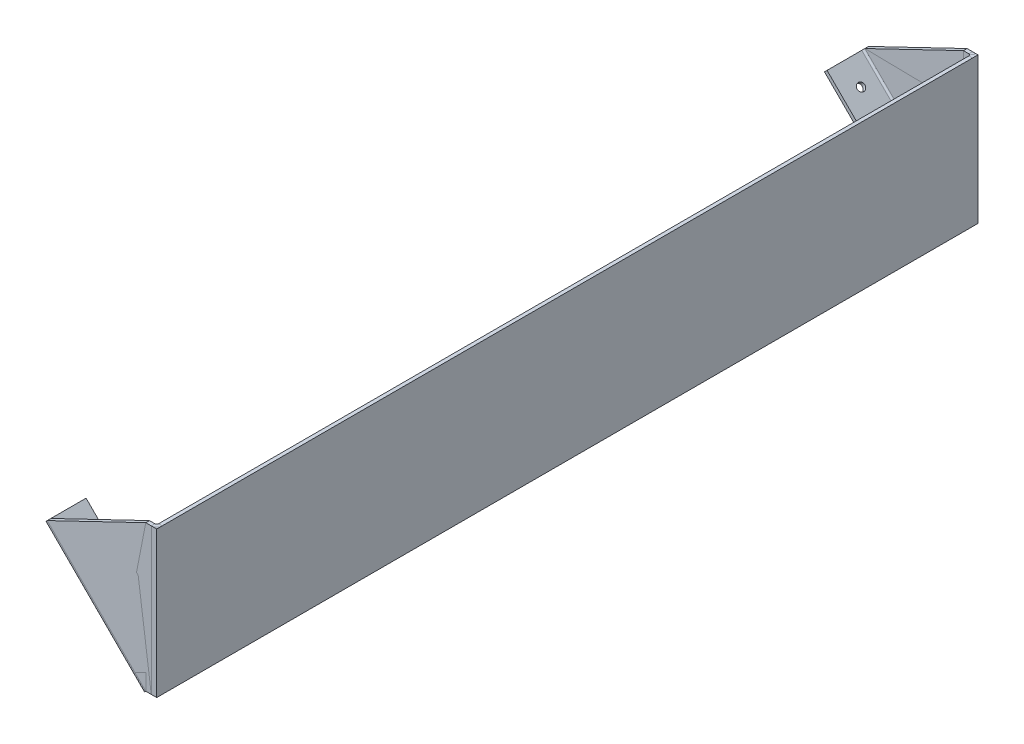
from build123d import *

# Parameters (mm, degrees)
SKETCH_1_W                       = 1
SKETCH_1_H                       = 40
EXTRUDE_1_DEPTH                  = 225
EXTRUDE_2_DEPTH                  = 1
EXTRUDE_3_DEPTH                  = 1
SHEET_METAL_1_OUTLINE_W          = 1
SHEET_METAL_1_OUTLINE_H          = 40
SHEET_METAL_1_DEPTH              = 225
SHEET_METAL_1_2_DEPTH            = 1.5
SHEET_START                      = 223.5
SHEET_METAL_1_3_DEPTH            = 1.5
SHEET_START_2                    = -1
SHEET_METAL_1_4_DEPTH            = 42
SM_EDGE_FLANGE_1_DEPTH           = 38.183766184
SM_EDGE_FLANGE_2_DEPTH           = 38.183766184
SKETCH_15_R                      = 1
CUT_EXTRUDE_1_DEPTH              = 231.496514702
HOLE_WIZARD_2_1_2_1_1_AT_2_COUNT = 2
HOLE_WIZARD_2_1_2_1_1_AT_2_PITCH = 13
HOLE_WIZARD_2_1_2_1_1_AT_3_COUNT = 2
HOLE_WIZARD_2_1_2_1_1_AT_3_PITCH = 26
HOLE_WIZARD_2_1_2_1_1_AT_4_COUNT = 2
HOLE_WIZARD_2_1_2_1_1_AT_4_PITCH = 213
HOLE_WIZARD_2_1_2_1_1_AT_5_COUNT = 2
HOLE_WIZARD_2_1_2_1_1_AT_5_PITCH = 213.396344861
HOLE_WIZARD_2_1_2_1_1_AT_6_COUNT = 2
HOLE_WIZARD_2_1_2_1_1_AT_6_PITCH = 214.580987042


with BuildPart() as part:
    # Sketch 1 → Бобышка-Вытянуть1 (new body)
    with BuildSketch(Plane.XY):
        with Locations((0.5, 20)):
            Rectangle(SKETCH_1_W, SKETCH_1_H)
    extrude(amount=EXTRUDE_1_DEPTH)

    # Эскиз2 → Бобышка-Вытянуть2 (add)
    with BuildSketch(Plane.XY.offset(225)):
        Polygon((1, 0), (-2, 0), (-29, 27), (-2, 40), (1, 40), align=None)
    extrude(amount=-EXTRUDE_2_DEPTH)

    # Эскиз4 → Бобышка-Вытянуть3 (add)
    with BuildSketch(Plane(origin=(0, 0, 0), x_dir=(-1, 0, 0), z_dir=(0, 0, -1))):
        Polygon((-1, 40), (2, 40), (29, 27), (2, 0), (-1, 0), align=None)
    extrude(amount=-EXTRUDE_3_DEPTH)


with BuildPart() as body_2:
    # Sheet Metal 1: read off the stored shape, not the designer's step
    # Sheet Metal 1 outline → Sheet Metal 1 (new body)
    with BuildSketch(Plane.XY):
        with Locations((0.5, 20)):
            Rectangle(SHEET_METAL_1_OUTLINE_W, SHEET_METAL_1_OUTLINE_H)
    extrude(amount=SHEET_METAL_1_DEPTH)

    # Sheet Metal 1 2 outline → Sheet Metal 1 2 (add)
    with BuildSketch(Plane.XY):
        Polygon((0, 0), (0, 40), (-2, 40), (-29, 27), (-2, 0), align=None)
    extrude(amount=SHEET_METAL_1_2_DEPTH)

    # Sheet Metal 1 3 outline → Sheet Metal 1 3 (add)
    with BuildSketch(Plane.XY.offset(SHEET_START)):
        Polygon((0, 0), (0, 40), (-2, 40), (-29, 27), (-2, 0), align=None)
    extrude(amount=SHEET_METAL_1_3_DEPTH)

    # Sheet Metal 1 4 outline → Sheet Metal 1 4 (cut)
    with BuildSketch(Plane(origin=(0, 0, 0), x_dir=(1, 0, 0), z_dir=(0, 1, 0)).offset(SHEET_START_2)):
        with BuildLine():
            Line((-31, -224), (-0.5, -224))
            ThreePointArc((-0.5, -224), (-0.146446609, -223.853553391), (0, -223.5))
            Line((0, -223.5), (-31, -223.5))
            Line((-31, -223.5), (-31, -224))
        make_face()
        with BuildLine():
            Line((-0.5, -225), (-31, -224.999999985))
            Line((-31, -224.999999985), (-31, -226))
            Line((-31, -226), (0.999999887, -226))
            Line((0.999999887, -226), (1, -223.5))
            ThreePointArc((1, -223.5), (0.560660172, -224.560660172), (-0.5, -225))
        make_face()
        with BuildLine():
            Line((-31, -1), (-31, -1.5))
            Line((-31, -1.5), (0, -1.5))
            ThreePointArc((0, -1.5), (-0.146446609, -1.146446609), (-0.5, -1))
            Line((-0.5, -1), (-31, -1))
        make_face()
        with BuildLine():
            Line((-31, 1), (-31, -1.5e-08))
            Line((-31, -1.5e-08), (-0.5, 0))
            ThreePointArc((-0.5, 0), (0.560660172, -0.439339828), (1, -1.5))
            Line((1, -1.5), (0.999999887, 1))
            Line((0.999999887, 1), (-31, 1))
        make_face()
    extrude(amount=SHEET_METAL_1_4_DEPTH, mode=Mode.SUBTRACT)

    # Ребро-кромка1: sheet metal written as solids
    # Ребро-кромка1 section (on a plane across the edge) → Ребро-кромка1 (add)
    with BuildSketch(Plane(origin=(-2.353553391, -0.353553391, 224), x_dir=(0.7071067811865476, 0.7071067811865475, -3.4914813388431334e-15), z_dir=(-0.7071067811865475, 0.7071067811865476, 0))):
        with BuildLine():
            Line((-1, 0.5), (-1, 10))
            Line((-1, 10), (0, 10))
            Line((0, 10), (0, 0.5))
            ThreePointArc((0, 0.5), (0.146446609, 0.146446609), (0.5, 0))
            Line((0.5, 0), (0.5, -1))
            ThreePointArc((0.5, -1), (-0.560660172, -0.560660172), (-1, 0.5))
        make_face()
    extrude(amount=SM_EDGE_FLANGE_1_DEPTH)

    # Ребро-кромка2: sheet metal written as solids
    # Ребро-кромка2 section (on a plane across the edge) → Ребро-кромка2 (add)
    with BuildSketch(Plane(origin=(-29.353553391, 26.646446609, 1), x_dir=(0.7071067811865476, 0.7071067811865475, 3.4914813388431334e-15), z_dir=(0.7071067811865475, -0.7071067811865476, 0))):
        with BuildLine():
            Line((-1, 0.5), (-1, 10))
            Line((-1, 10), (0, 10))
            Line((0, 10), (0, 0.5))
            ThreePointArc((0, 0.5), (0.146446609, 0.146446609), (0.5, 0))
            Line((0.5, 0), (0.5, -1))
            ThreePointArc((0.5, -1), (-0.560660172, -0.560660172), (-1, 0.5))
        make_face()
    extrude(amount=SM_EDGE_FLANGE_2_DEPTH)

    # Эскиз15 → Вырез-Вытянуть1 (cut, through all)
    with BuildSketch(Plane.XY.offset(225)):
        with Locations((-4.995026007, 26)):
            Circle(SKETCH_15_R)
    extrude(amount=-CUT_EXTRUDE_1_DEPTH, mode=Mode.SUBTRACT)

    # Эскиз16 → Диаметр отверстия Ø2.1 (2.1)1 (revolve, cut)
    with BuildSketch(Plane(origin=(-25.753048327, 21.631727984, 219), x_dir=(0.7071067811865475, -0.7071067811865477, 0), z_dir=(0, 0, 1))):
        Polygon((0, 0), (0, 5.63090365), (1.05, 5), (1.05, 0), align=None)
    hole_wizard_2_1_2_1_1 = revolve(axis=Axis((-30.243176388, 17.141599923, 219), (0.7071067811865476, 0.7071067811865474, -3.4812242521929712e-15)), mode=Mode.SUBTRACT)

    # Диаметр отверстия Ø2.1 (2.1)1 at 2: Диаметр отверстия Ø2.1 (2.1)1 ×2
    with Locations(*[Vector(0.7071067811865476, -0.7071067811865476, 3.886729494756105e-15) * (i * HOLE_WIZARD_2_1_2_1_1_AT_2_PITCH) for i in range(1, HOLE_WIZARD_2_1_2_1_1_AT_2_COUNT)]):
        add(hole_wizard_2_1_2_1_1, mode=Mode.SUBTRACT)

    # Диаметр отверстия Ø2.1 (2.1)1 at 3: Диаметр отверстия Ø2.1 (2.1)1 ×2
    with Locations(*[Vector(0.7071067811865476, -0.7071067811865476, 3.0365074177782066e-15) * (i * HOLE_WIZARD_2_1_2_1_1_AT_3_PITCH) for i in range(1, HOLE_WIZARD_2_1_2_1_1_AT_3_COUNT)]):
        add(hole_wizard_2_1_2_1_1, mode=Mode.SUBTRACT)

    # Диаметр отверстия Ø2.1 (2.1)1 at 4: Диаметр отверстия Ø2.1 (2.1)1 ×2
    with Locations(*[(0, 0, -i * HOLE_WIZARD_2_1_2_1_1_AT_4_PITCH) for i in range(1, HOLE_WIZARD_2_1_2_1_1_AT_4_COUNT)]):
        add(hole_wizard_2_1_2_1_1, mode=Mode.SUBTRACT)

    # Диаметр отверстия Ø2.1 (2.1)1 at 5: Диаметр отверстия Ø2.1 (2.1)1 ×2
    with Locations(*[Vector(0.04307659609360352, -0.04307659609360844, -0.9981426820540121) * (i * HOLE_WIZARD_2_1_2_1_1_AT_5_PITCH) for i in range(1, HOLE_WIZARD_2_1_2_1_1_AT_5_COUNT)]):
        add(hole_wizard_2_1_2_1_1, mode=Mode.SUBTRACT)

    # Диаметр отверстия Ø2.1 (2.1)1 at 6: Диаметр отверстия Ø2.1 (2.1)1 ×2
    with Locations(*[Vector(0.085677564281292, -0.0856775642812969, -0.9926322128349702) * (i * HOLE_WIZARD_2_1_2_1_1_AT_6_PITCH) for i in range(1, HOLE_WIZARD_2_1_2_1_1_AT_6_COUNT)]):
        add(hole_wizard_2_1_2_1_1, mode=Mode.SUBTRACT)


solid = Compound([part.part, body_2.part])
